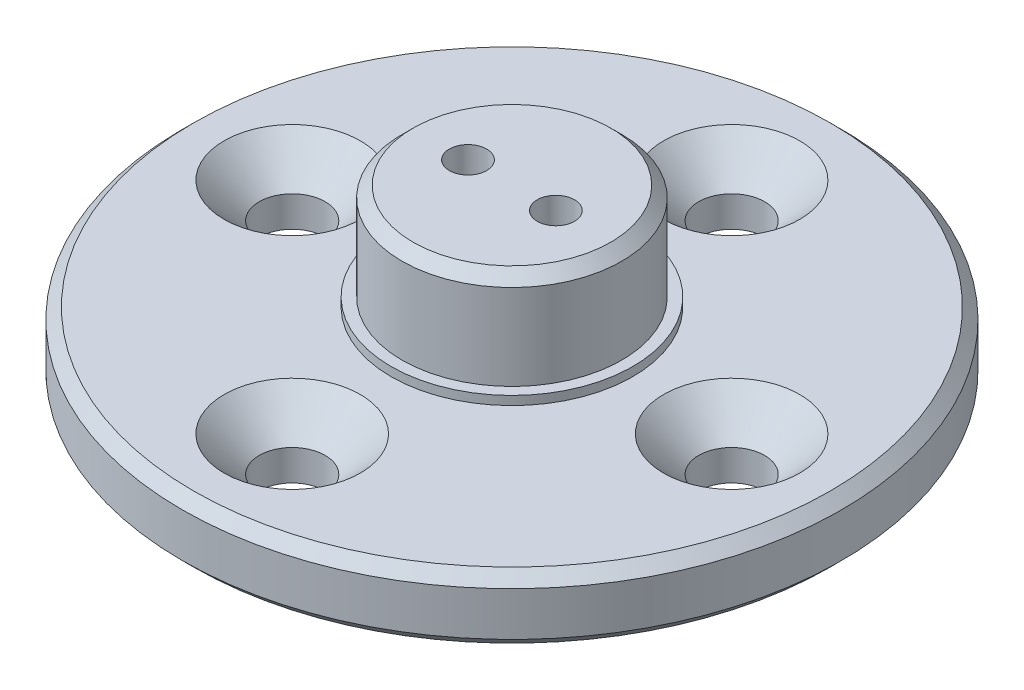
from build123d import *

# Parameters (mm, degrees)
SKETCH_1_R      = 15
SKETCH_1_R_2    = 1.5
EXTRUDE_1_DEPTH = 3
SKETCH_2_R      = 5
SKETCH_2_R_2    = 0.85
EXTRUDE_2_DEPTH = 4.8
SKETCH_4_R      = 5.5
EXTRUDE_3_DEPTH = 0.4
CHAMFER_1_SIZE  = 0.5
CHAMFER_3_SIZE  = 0.5
CHAMFER_4_SIZE  = 1.6


with BuildPart() as part:
    # 草图1 → 凸台-拉伸1 (new body)
    with BuildSketch(Plane(origin=(0, 0, 0), x_dir=(1, 0, 0), z_dir=(0, 1, 0))):
        Circle(SKETCH_1_R)
        with Locations((0, 10)):
            Circle(SKETCH_1_R_2, mode=Mode.SUBTRACT)
        with Locations((10, 0)):
            Circle(SKETCH_1_R_2, mode=Mode.SUBTRACT)
        with Locations((0, -10)):
            Circle(SKETCH_1_R_2, mode=Mode.SUBTRACT)
        with Locations((-10, 0)):
            Circle(SKETCH_1_R_2, mode=Mode.SUBTRACT)
    extrude(amount=EXTRUDE_1_DEPTH)

    # 草图2 → 凸台-拉伸2 (add)
    with BuildSketch(Plane(origin=(0, 3, 0), x_dir=(1, 0, 0), z_dir=(0, 1, 0))):
        Circle(SKETCH_2_R)
        with Locations((2, 0)):
            Circle(SKETCH_2_R_2, mode=Mode.SUBTRACT)
        with Locations((-2, 0)):
            Circle(SKETCH_2_R_2, mode=Mode.SUBTRACT)
    extrude(amount=EXTRUDE_2_DEPTH)

    # 草图4 → 凸台-拉伸3 (add)
    with BuildSketch(Plane(origin=(0, 3, 0), x_dir=(1, 0, 0), z_dir=(0, 1, 0))):
        Circle(SKETCH_4_R)
    extrude(amount=EXTRUDE_3_DEPTH)

    # 倒角1
    chamfer_1_edges = [part.edges().sort_by_distance(p)[0] for p in [
        (-5, 7.8, 0),
    ]]
    chamfer(chamfer_1_edges, length=CHAMFER_1_SIZE)

    # 倒角3
    chamfer_3_edges = [part.edges().sort_by_distance(p)[0] for p in [
        (-15, 0, 0),
        (-15, 3, 0),
    ]]
    chamfer(chamfer_3_edges, length=CHAMFER_3_SIZE)

    # 倒角4
    chamfer_4_edges = [part.edges().sort_by_distance(p)[0] for p in [
        (8.5, 3, 0),
        (-1.5, 3, 10),
        (-11.5, 3, 0),
        (-1.5, 3, -10),
    ]]
    chamfer(chamfer_4_edges, length=CHAMFER_4_SIZE)


solid = part.part
